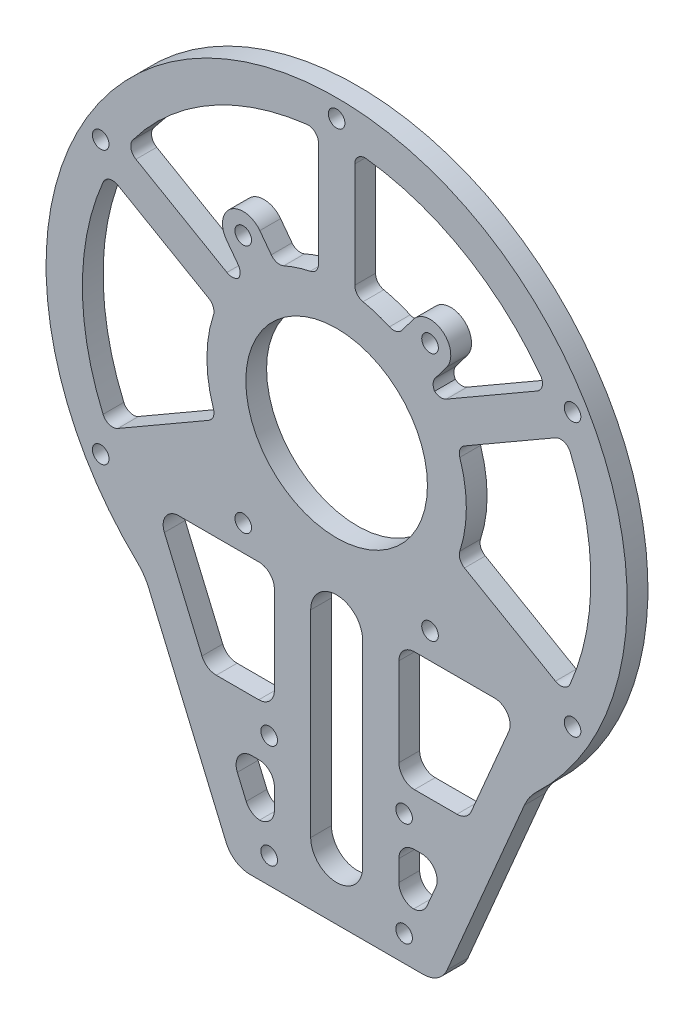
from build123d import *

# Parameters (mm, degrees)
SKETCH_1_R          = 1.6
EXTRUDE_1_DEPTH     = 4
FILLET_1_R          = 10
FILLET_2_R          = 5
SKETCH_2_R          = 1.6
CUT_EXTRUDE_3_DEPTH = 10
SKETCH_3_R          = 17.5
CUT_EXTRUDE_4_DEPTH = 10
FILLET_3_R          = 2
CUT_EXTRUDE_5_DEPTH = 10
FILLET_4_R          = 3


with BuildPart() as part:
    # 草图1 → 凸台-拉伸1 (new body)
    # profile 1 of 13: a face of its own
    with BuildSketch(Plane.XY):
        with BuildLine():
            Line((-37.040518355, -42), (-31.5, -42))
            Line((-31.5, -42), (-20, -42))
            Line((-20, -42), (0, -42))
            Line((0, -42), (20, -42))
            Line((20, -42), (31.5, -42))
            Line((31.5, -42), (37.040518355, -42))
            ThreePointArc((37.040518355, -42), (51.040518355, -23.040518355), (56, 0))
            ThreePointArc((56, 0), (-23.040518355, 51.040518355), (-37.040518355, -42))
        make_face()
        with Locations((-45.466333699, -26.25)):
            Circle(SKETCH_1_R, mode=Mode.SUBTRACT)
        with Locations((-18, -24)):
            Circle(SKETCH_1_R, mode=Mode.SUBTRACT)
        with Locations((18, -24)):
            Circle(SKETCH_1_R, mode=Mode.SUBTRACT)
        with Locations((45.466333699, -26.25)):
            Circle(SKETCH_1_R, mode=Mode.SUBTRACT)
        with Locations((-45.466333699, 26.25)):
            Circle(SKETCH_1_R, mode=Mode.SUBTRACT)
        with Locations((-18, 24)):
            Circle(SKETCH_1_R, mode=Mode.SUBTRACT)
        with Locations((18, 24)):
            Circle(SKETCH_1_R, mode=Mode.SUBTRACT)
        with Locations((0, 52.5)):
            Circle(SKETCH_1_R, mode=Mode.SUBTRACT)
        with Locations((45.466333699, 26.25)):
            Circle(SKETCH_1_R, mode=Mode.SUBTRACT)
    # profile 2 of 13: a face of its own
    with BuildSketch(Plane.XY):
        with BuildLine():
            Line((20, -82), (37.040518355, -42))
            ThreePointArc((37.040518355, -42), (28.982109133, -47.916983943), (20, -52.306787322))
            Line((20, -52.306787322), (20, -82))
        make_face()
    # profile 3 of 13: a face of its own
    with BuildSketch(Plane.XY):
        with BuildLine():
            Line((31.5, -42), (20, -42))
            Line((20, -42), (20, -52.306787322))
            ThreePointArc((20, -52.306787322), (28.982109133, -47.916983943), (37.040518355, -42))
            Line((37.040518355, -42), (31.5, -42))
        make_face()
    # profile 4 of 13: a face of its own
    with BuildSketch(Plane.XY):
        with BuildLine():
            Line((20, -42), (0, -42))
            Line((0, -42), (0, -50.9))
            ThreePointArc((0, -50.9), (1.13137085, -51.36862915), (1.6, -52.5))
            ThreePointArc((1.6, -52.5), (1.13137085, -53.63137085), (0, -54.1))
            Line((0, -54.1), (0, -56))
            ThreePointArc((0, -56), (10.16906854, -55.068957181), (20, -52.306787322))
            Line((20, -52.306787322), (20, -42))
        make_face()
    # profile 5 of 13: a face of its own
    with BuildSketch(Plane.XY):
        with BuildLine():
            ThreePointArc((20, -52.306787322), (10.16906854, -55.068957181), (0, -56))
            Line((0, -56), (0, -82))
            Line((0, -82), (20, -82))
            Line((20, -82), (20, -52.306787322))
        make_face()
    # profile 6 of 13: a face of its own
    with BuildSketch(Plane.XY):
        with BuildLine():
            ThreePointArc((0, -56), (-10.16906854, -55.068957181), (-20, -52.306787322))
            Line((-20, -52.306787322), (-20, -82))
            Line((-20, -82), (0, -82))
            Line((0, -82), (0, -56))
        make_face()
    # profile 7 of 13: a face of its own
    with BuildSketch(Plane.XY):
        with BuildLine():
            Line((0, -42), (-20, -42))
            Line((-20, -42), (-20, -52.306787322))
            ThreePointArc((-20, -52.306787322), (-10.16906854, -55.068957181), (0, -56))
            Line((0, -56), (0, -54.1))
            ThreePointArc((0, -54.1), (-1.6, -52.5), (0, -50.9))
            Line((0, -50.9), (0, -42))
        make_face()
    # profile 8 of 13: a face of its own
    with BuildSketch(Plane.XY):
        with BuildLine():
            ThreePointArc((-20, -52.306787322), (-28.982109133, -47.916983943), (-37.040518355, -42))
            Line((-37.040518355, -42), (-20, -82))
            Line((-20, -82), (-20, -52.306787322))
        make_face()
    # profile 9 of 13: a face of its own
    with BuildSketch(Plane.XY):
        with BuildLine():
            Line((-20, -42), (-31.5, -42))
            Line((-31.5, -42), (-37.040518355, -42))
            ThreePointArc((-37.040518355, -42), (-28.982109133, -47.916983943), (-20, -52.306787322))
            Line((-20, -52.306787322), (-20, -42))
        make_face()
    # profile 10 of 13: a face of its own
    with BuildSketch(Plane.XY):
        with BuildLine():
            ThreePointArc((1.6, -52.5), (1.13137085, -51.36862915), (0, -50.9))
            Line((0, -50.9), (0, -54.1))
            ThreePointArc((0, -54.1), (1.13137085, -53.63137085), (1.6, -52.5))
        make_face()
    # profile 11 of 13: a face of its own
    with BuildSketch(Plane.XY):
        with BuildLine():
            Line((0, -54.1), (0, -50.9))
            ThreePointArc((0, -50.9), (-1.6, -52.5), (0, -54.1))
        make_face()
    # profile 12 of 13: a face of its own
    with BuildSketch(Plane.XY):
        with BuildLine():
            ThreePointArc((1.6, -52.5), (1.13137085, -51.36862915), (0, -50.9))
            Line((0, -50.9), (0, -54.1))
            ThreePointArc((0, -54.1), (1.13137085, -53.63137085), (1.6, -52.5))
        make_face()
    # profile 13 of 13: a face of its own
    with BuildSketch(Plane.XY):
        with BuildLine():
            Line((0, -54.1), (0, -50.9))
            ThreePointArc((0, -50.9), (-1.6, -52.5), (0, -54.1))
        make_face()
    extrude(amount=EXTRUDE_1_DEPTH)

    # 圆角1
    fillet_1_edges = [part.edges().sort_by_distance(p)[0] for p in [
        (-37.040518355, -42, 2),
        (37.040518355, -42, 2),
    ]]
    fillet(fillet_1_edges, radius=FILLET_1_R)

    # 圆角2
    fillet_2_edges = [part.edges().sort_by_distance(p)[0] for p in [
        (-20, -82, 2),
        (20, -82, 2),
    ]]
    fillet(fillet_2_edges, radius=FILLET_2_R)

    # 草图2 → 切除-拉伸3 (cut)
    with BuildSketch(Plane.XY.offset(4)):
        with BuildLine():
            Line((-3.5, 24.753787589), (-3.5, 48.874840153))
            ThreePointArc((-3.5, 48.874840153), (-24.5, 42.435244785), (-40.576853179, 27.46850899))
            Line((-40.576853179, 27.46850899), (-19.687408892, 15.407982708))
            ThreePointArc((-19.687408892, 15.407982708), (-18.871882173, 16.396708915), (-18.006755215, 17.342340287))
            Line((-18.006755215, 17.342340287), (-21.2, 21.6))
            ThreePointArc((-21.2, 21.6), (-20.4, 27.2), (-14.8, 26.4))
            Line((-14.8, 26.4), (-11.606755215, 22.142340287))
            ThreePointArc((-11.606755215, 22.142340287), (-7.66540459, 23.795830989), (-3.5, 24.753787589))
        make_face()
        with BuildLine():
            ThreePointArc((40.576853179, 27.46850899), (24.5, 42.435244785), (3.5, 48.874840153))
            Line((3.5, 48.874840153), (3.5, 24.753787589))
            ThreePointArc((3.5, 24.753787589), (7.66540459, 23.795830989), (11.606755215, 22.142340287))
            Line((11.606755215, 22.142340287), (14.8, 26.4))
            ThreePointArc((14.8, 26.4), (20.4, 27.2), (21.2, 21.6))
            Line((21.2, 21.6), (18.006755215, 17.342340287))
            ThreePointArc((18.006755215, 17.342340287), (18.871882173, 16.396708915), (19.687408892, 15.407982708))
            Line((19.687408892, 15.407982708), (40.576853179, 27.46850899))
        make_face()
        with BuildLine():
            ThreePointArc((-23.187408892, -9.345804881), (-25, 0), (-23.187408892, 9.345804881))
            Line((-23.187408892, 9.345804881), (-44.076853179, 21.406331163))
            ThreePointArc((-44.076853179, 21.406331163), (-49, 0), (-44.076853179, -21.406331163))
            Line((-44.076853179, -21.406331163), (-23.187408892, -9.345804881))
        make_face()
        with BuildLine():
            Line((44.076853179, 21.406331163), (23.187408892, 9.345804881))
            ThreePointArc((23.187408892, 9.345804881), (25, 0), (23.187408892, -9.345804881))
            Line((23.187408892, -9.345804881), (44.076853179, -21.406331163))
            ThreePointArc((44.076853179, -21.406331163), (49, 0), (44.076853179, 21.406331163))
        make_face()
        with BuildLine():
            Line((-5, -32), (-5, -70))
            ThreePointArc((-5, -70), (0, -75), (5, -70))
            Line((5, -70), (5, -32))
            ThreePointArc((5, -32), (0, -27), (-5, -32))
        make_face()
        with Locations((-13, -77)):
            Circle(SKETCH_2_R)
        with Locations((-13, -57)):
            Circle(SKETCH_2_R)
        with Locations((13, -57)):
            Circle(SKETCH_2_R)
        with Locations((13, -77)):
            Circle(SKETCH_2_R)
    extrude(amount=-CUT_EXTRUDE_3_DEPTH, mode=Mode.SUBTRACT)

    # 草图3 → 切除-拉伸4 (cut)
    with BuildSketch(Plane(origin=(0, 0, 0), x_dir=(-1, 0, 0), z_dir=(0, 0, -1))):
        Circle(SKETCH_3_R)
    extrude(amount=-CUT_EXTRUDE_4_DEPTH, mode=Mode.SUBTRACT)

    # 圆角3
    # the kernel refuses this fillet: 2 mm, written as the material it adds along each edge
    with BuildSketch(Plane(origin=(44.076853179, -21.406331163, 4), x_dir=(0.4161517184579159, 0.9092951925664864, 0), z_dir=(0, 0, -1)), Plane(origin=(40.576853179, 27.46850899, 4), x_dir=(-0.5793968770727322, 0.8150455562963123, 0), z_dir=(0, 0, -1)), Plane(origin=(-44.076853179, 21.406331163, 4), x_dir=(-0.4161517184579201, -0.9092951925664845, 0), z_dir=(0, 0, -1)), Plane(origin=(-3.5, 48.874840153, 4), x_dir=(-0.9955485955305929, -0.09424963627019442, 0), z_dir=(0, 0, -1))) as fillet_3_piece_1:
        with BuildLine():
            CenterArc((2.198235081, -1.9994756), FILLET_3_R, 88.687910399, 96.72022296)
            Line((0.20713789, -2.187974872), (0, 0))
            ThreePointArc((0, 0), (1.122015823, 0.012847802), (2.244031646, 0))
        make_face()
    extrude(amount=4)
    with BuildSketch(Plane(origin=(23.187408892, -9.345804881, 4), x_dir=(0.8660254037844346, -0.500000000000007, 0), z_dir=(0, 0, -1)), Plane(origin=(19.687408892, 15.407982708, 4), x_dir=(0.8660254037844409, 0.4999999999999962, 0), z_dir=(0, 0, -1)), Plane(origin=(-3.5, 24.753787589, 4), x_dir=(0, 1, 0), z_dir=(0, 0, -1))) as fillet_3_piece_2:
        with BuildLine():
            CenterArc((1.680092187, -2), FILLET_3_R, 90, 78.246374383)
            ThreePointArc((-0.277972982, -1.592592593), (-0.126109645, -0.798543836), (0, 0))
            Line((0, 0), (1.680092187, 0))
        make_face()
    extrude(amount=4)
    with BuildSketch(Plane(origin=(23.187408892, 9.345804881, 4), x_dir=(0.8660254037844413, 0.49999999999999545, 0), z_dir=(0, 0, -1)), Plane(origin=(3.5, 24.753787589, 4), x_dir=(0, 1, 0), z_dir=(0, 0, -1)), Plane(origin=(-23.187408892, -9.345804881, 4), x_dir=(-0.8660254037844479, -0.49999999999998407, 0), z_dir=(0, 0, -1)), Plane(origin=(-19.687408892, 15.407982708, 4), x_dir=(-0.8660254037844282, 0.5000000000000182, 0), z_dir=(0, 0, -1))) as fillet_3_piece_3:
        with BuildLine():
            CenterArc((1.680092187, 2), FILLET_3_R, 191.753625617, 78.246374383)
            ThreePointArc((-0.277972982, 1.592592593), (-0.126109645, 0.798543836), (0, 0))
            Line((0, 0), (1.680092187, 0))
        make_face()
    extrude(amount=4)
    with BuildSketch(Plane(origin=(44.076853179, 21.406331163, 4), x_dir=(0.4161517184579126, -0.9092951925664878, 0), z_dir=(0, 0, -1)), Plane(origin=(3.5, 48.874840153, 4), x_dir=(0.9955485955305919, -0.09424963627020293, 0), z_dir=(0, 0, -1))) as fillet_3_piece_4:
        with BuildLine():
            CenterArc((2.198235081, 1.9994756), FILLET_3_R, 174.591866641, 96.72022296)
            Line((0.20713789, 2.187974872), (0, 0))
            ThreePointArc((0, 0), (1.122015823, -0.012847802), (2.244031646, 0))
        make_face()
    extrude(amount=4)
    with BuildSketch(Plane(origin=(18.006755215, 17.342340287, 4), x_dir=(0.6705154511323562, -0.7418955652871723, 0), z_dir=(0, 0, -1)), Plane(origin=(-11.606755215, 22.142340287, 4), x_dir=(0.8999640689927433, 0.43596407480665733, 0), z_dir=(0, 0, -1))) as fillet_3_piece_5:
        with BuildLine():
            CenterArc((1.648187328, -1.998995117), FILLET_3_R, 91.816346093, 77.160411593)
            Line((-0.314912072, -1.616580754), (0, 0))
            ThreePointArc((0, 0), (0.792397754, -0.01256104), (1.584795508, 0))
        make_face()
    extrude(amount=4)
    with BuildSketch(Plane(origin=(11.606755215, 22.142340287, 4), x_dir=(-0.8999640689927446, 0.43596407480665467, 0), z_dir=(0, 0, -1)), Plane(origin=(-18.006755215, 17.342340287, 4), x_dir=(-0.6705154511323576, -0.7418955652871712, 0), z_dir=(0, 0, -1))) as fillet_3_piece_6:
        with BuildLine():
            CenterArc((1.648187328, 1.998995117), FILLET_3_R, 191.023242314, 77.160411593)
            Line((-0.314912072, 1.616580754), (0, 0))
            ThreePointArc((0, 0), (0.792397754, 0.01256104), (1.584795508, 0))
        make_face()
    extrude(amount=4)
    with BuildSketch(Plane(origin=(-23.187408892, 9.345804881, 4), x_dir=(-0.34364763241930923, -0.9390986661329059, 0), z_dir=(0, 0, -1))) as fillet_3_piece_7:
        with BuildLine():
            CenterArc((1.681336239, 1.998954279), FILLET_3_R, 189.900735932, 78.246374383)
            Line((-0.288877997, 1.655070772), (0, 0))
            ThreePointArc((0, 0), (0.80833473, 0.013071518), (1.616669461, 0))
        make_face()
    extrude(amount=4)
    with BuildSketch(Plane(origin=(-44.076853179, -21.406331163, 4), x_dir=(0.8660254037845937, 0.49999999999973144, 0), z_dir=(0, 0, -1)), Plane(origin=(-40.576853179, 27.46850899, 4), x_dir=(0.8660254037845372, -0.49999999999982914, 0), z_dir=(0, 0, -1))) as fillet_3_piece_8:
        with BuildLine():
            CenterArc((2.197757982, -2), FILLET_3_R, 90, 96.72022296)
            ThreePointArc((0.211499166, -2.234042553), (0.092958972, -1.118232177), (0, 0))
            Line((0, 0), (2.197757982, 0))
        make_face()
    extrude(amount=4)

    # 草图4 → 切除-拉伸5 (cut)
    with BuildSketch(Plane.XY.offset(4)):
        Polygon((12, -29), (12, -52), (25.171652668, -52), (34.969950722, -29), align=None)
        Polygon((-34.969950722, -29), (-12, -29), (-12, -52), (-25.171652668, -52), align=None)
        Polygon((12, -62), (20.911523079, -62), (16.65139349, -72), (12, -72), align=None)
        Polygon((-12, -72), (-12, -62), (-20.911523079, -62), (-16.65139349, -72), align=None)
    extrude(amount=-CUT_EXTRUDE_5_DEPTH, mode=Mode.SUBTRACT)

    # 圆角4
    # the kernel refuses this fillet: 3 mm, written as the material it adds along each edge
    with BuildSketch(Plane(origin=(25.171652668, -52, 4), x_dir=(-1, 0, 0), z_dir=(0, 0, -1)), Plane(origin=(-16.65139349, -72, 4), x_dir=(-0.39192983874569454, 0.9199951094982918, 0), z_dir=(0, 0, -1)), Plane(origin=(16.65139349, -72, 4), x_dir=(-1, 0, 0), z_dir=(0, 0, -1)), Plane(origin=(-25.171652668, -52, 4), x_dir=(-0.39192983874569626, 0.919995109498291, 0), z_dir=(0, 0, -1))) as fillet_4_piece_1:
        with BuildLine():
            CenterArc((FILLET_4_R * 0.6609493409, FILLET_4_R), FILLET_4_R, 203.074633013, 66.925366987)
            Line((-FILLET_4_R * 0.259045768598, FILLET_4_R * 0.608070161254), (0, 0))
            Line((0, 0), (FILLET_4_R * 0.6609493409, 0))
        make_face()
    extrude(amount=4)
    with BuildSketch(Plane(origin=(12, -52, 4), x_dir=(0, 1, 0), z_dir=(0, 0, -1)), Plane(origin=(-12, -62, 4), x_dir=(0, -1, 0), z_dir=(0, 0, -1)), Plane(origin=(12, -72, 4), x_dir=(0, 1, 0), z_dir=(0, 0, -1)), Plane(origin=(-12, -29, 4), x_dir=(0, -1, 0), z_dir=(0, 0, -1)), Plane(origin=(-12, -52, 4), x_dir=(-1, 0, 0), z_dir=(0, 0, -1))) as fillet_4_piece_2:
        with BuildLine():
            CenterArc((FILLET_4_R, FILLET_4_R), FILLET_4_R, 180, 90)
            Line((0, FILLET_4_R), (0, 0))
            Line((0, 0), (FILLET_4_R, 0))
        make_face()
    extrude(amount=4)
    with BuildSketch(Plane(origin=(12, -29, 4), x_dir=(0, -1, 0), z_dir=(0, 0, -1)), Plane(origin=(-12, -72, 4), x_dir=(0, 1, 0), z_dir=(0, 0, -1)), Plane(origin=(12, -62, 4), x_dir=(0, -1, 0), z_dir=(0, 0, -1))) as fillet_4_piece_3:
        with BuildLine():
            CenterArc((FILLET_4_R, -FILLET_4_R), FILLET_4_R, 90, 90)
            Line((0, -FILLET_4_R), (0, 0))
            Line((0, 0), (FILLET_4_R, 0))
        make_face()
    extrude(amount=4)
    with BuildSketch(Plane(origin=(34.969950722, -29, 4), x_dir=(-0.3919298387456947, -0.9199951094982918, 0), z_dir=(0, 0, -1)), Plane(origin=(-20.911523079, -62, 4), x_dir=(1, 0, 0), z_dir=(0, 0, -1)), Plane(origin=(20.911523079, -62, 4), x_dir=(-0.39192983874569465, -0.9199951094982918, 0), z_dir=(0, 0, -1))) as fillet_4_piece_4:
        with BuildLine():
            CenterArc((FILLET_4_R * 1.51297525865, FILLET_4_R), FILLET_4_R, 156.925366987, 113.074633013)
            Line((FILLET_4_R * 0.592980149147, FILLET_4_R * 1.39192983875), (0, 0))
            Line((0, 0), (FILLET_4_R * 1.51297525865, 0))
        make_face()
    extrude(amount=4)
    with BuildSketch(Plane(origin=(-34.969950722, -29, 4), x_dir=(0.39192983874569454, -0.9199951094982919, 0), z_dir=(0, 0, -1))) as fillet_4_piece_5:
        with BuildLine():
            CenterArc((FILLET_4_R * 1.51297525865, -FILLET_4_R), FILLET_4_R, 90, 113.074633013)
            Line((FILLET_4_R * 0.592980149147, -FILLET_4_R * 1.39192983875), (0, 0))
            Line((0, 0), (FILLET_4_R * 1.51297525865, 0))
        make_face()
    extrude(amount=4)


solid = part.part
